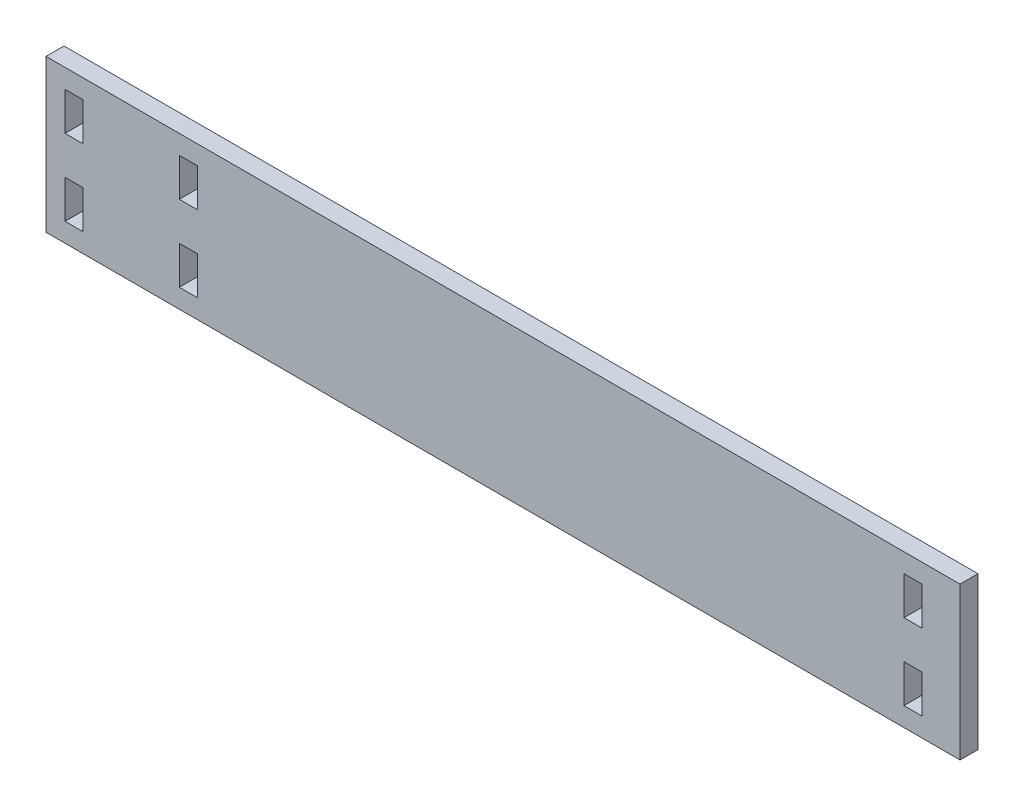
from build123d import *

# Parameters (mm, degrees)
SKETCH1_W           = 304.8
SKETCH1_H           = 50.8
SKETCH1_W_2         = 5.9944
SKETCH1_H_2         = 12.7
BOSS_EXTRUDE1_DEPTH = 5.9944


with BuildPart() as part:
    # Sketch1 → Boss-Extrude1 (new body)
    with BuildSketch(Plane.XY):
        with Locations((-152.4, 25.4)):
            Rectangle(SKETCH1_W, SKETCH1_H)
        with Locations((-15.6972, 12.7)):
            Rectangle(SKETCH1_W_2, SKETCH1_H_2, mode=Mode.SUBTRACT)
        with Locations((-15.6972, 38.1)):
            Rectangle(SKETCH1_W_2, SKETCH1_H_2, mode=Mode.SUBTRACT)
        with Locations((-257.3528, 38.1)):
            Rectangle(SKETCH1_W_2, SKETCH1_H_2, mode=Mode.SUBTRACT)
        with Locations((-257.3528, 12.7)):
            Rectangle(SKETCH1_W_2, SKETCH1_H_2, mode=Mode.SUBTRACT)
        with Locations((-295.4528, 12.7)):
            Rectangle(SKETCH1_W_2, SKETCH1_H_2, mode=Mode.SUBTRACT)
        with Locations((-295.4528, 38.1)):
            Rectangle(SKETCH1_W_2, SKETCH1_H_2, mode=Mode.SUBTRACT)
    extrude(amount=BOSS_EXTRUDE1_DEPTH)


solid = part.part
